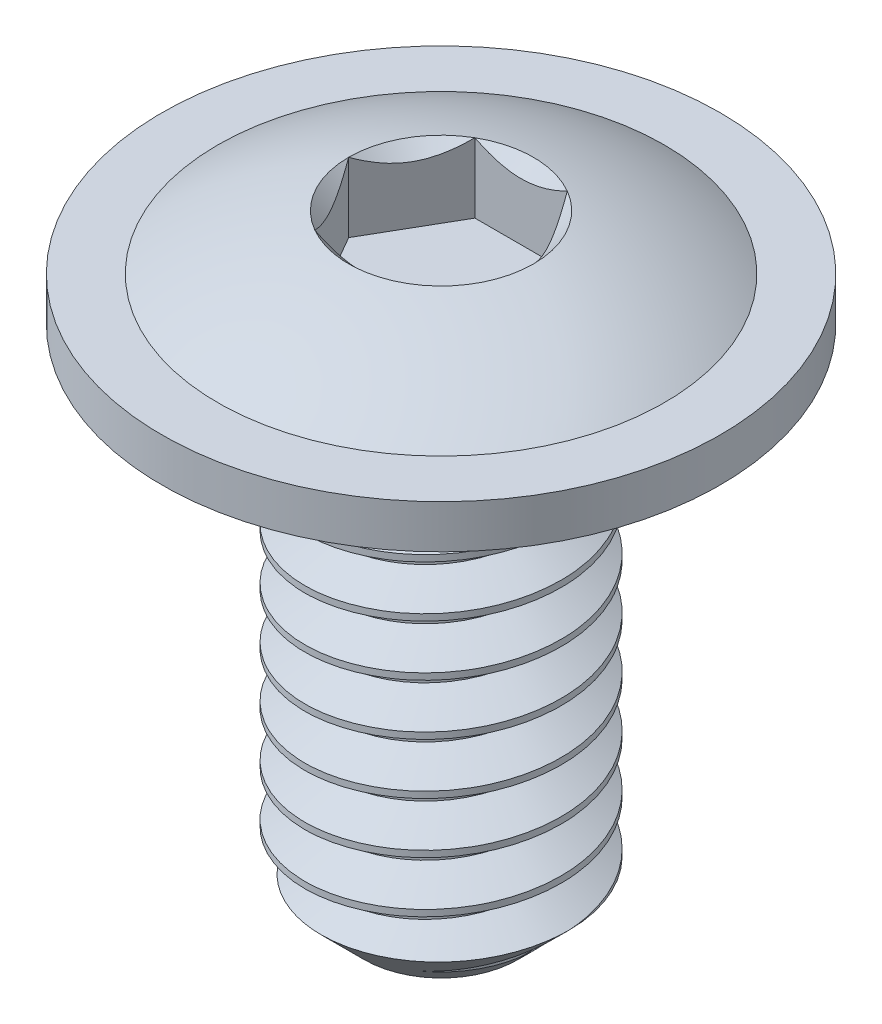
from build123d import *

# Parameters (mm, degrees)
SKETCH2_W                    = 3.175
SKETCH2_H                    = 12.7
CHAMFER1_SIZE                = 1.27
CUT_SWEEP1_PITCH             = 1.27
CUT_EXTRUDE1_DEPTH           = 1.984375
SKETCH7_R                    = 2.291358881
CUT_EXTRUDE2_DEPTH           = 1.726209
CUT_EXTRUDE2_TAPER           = 45
CUT_EXTRUDE2_OTHER_WAY_DEPTH = 19.02385524


with BuildPart() as part:
    # Sketch2 → Revolve2 (revolve)
    with BuildSketch(Plane.XY, mode=Mode.PRIVATE) as revolve2_sk:
        with Locations((-1.5875, 6.35)):
            Rectangle(SKETCH2_W, SKETCH2_H)
    revolve(revolve2_sk.sketch.rotate(Axis((0, 0, 0), (0, 1, 0)), 270), axis=Axis((0, 0, 0), (0, 1, 0)))

    # Chamfer1
    chamfer1_edges = [part.edges().sort_by_distance(p)[0] for p in [
        (0, 0, 3.175),
    ]]
    chamfer(chamfer1_edges, length=CHAMFER1_SIZE)

    # Cut-Sweep1: the profile of Sketch4 profile screwed along a right-hand helix of 13.75 turns, 6 arcs to a turn; built about Z, then put on its axis
    cut_sweep1_z = Axis((0, 0, 0), (0, 0, 1))
    cut_sweep1_corners = [(3.1753, 0, -1.111423205), (3.1753, 0, 0.000173205), (2.350110803, 0, -0.47625), (2.350110803, 0, -0.635)]
    with BuildLine(mode=Mode.PRIVATE) as cut_sweep1_profile:
        Line(cut_sweep1_corners[0], cut_sweep1_corners[1])
        Line(cut_sweep1_corners[1], cut_sweep1_corners[2])
        Line(cut_sweep1_corners[2], cut_sweep1_corners[3])
        Line(cut_sweep1_corners[3], cut_sweep1_corners[0])
    cut_sweep1_cap = Face(cut_sweep1_profile.wire())
    cut_sweep1_turn_angles = [0, 30, 60, 90, 120, 150, 180, 210, 240, 270, 300, 330, 360]
    cut_sweep1_turn_weights = [1, 0.8660254037844387, 1, 0.8660254037844387, 1, 0.8660254037844387, 1, 0.8660254037844387, 1, 0.8660254037844387, 1, 0.8660254037844387, 1]
    cut_sweep1_turn_rails = [Edge.make_bspline([Vector(p[0], p[1], 0).rotate(cut_sweep1_z, cut_sweep1_turn_angles[k]) / cut_sweep1_turn_weights[k] + Vector(0, 0, p[2] + CUT_SWEEP1_PITCH * cut_sweep1_turn_angles[k] / 360) for k in range(13)], [0, 0, 0, 1, 1, 2, 2, 3, 3, 4, 4, 5, 5, 6, 6, 6], 2, cut_sweep1_turn_weights) for p in cut_sweep1_corners]
    cut_sweep1_turn_sides = [Face.make_surface_from_curves(cut_sweep1_turn_rails[p[0]], cut_sweep1_turn_rails[p[1]]) for p in [(0, 1), (1, 2), (2, 3), (3, 0)]]
    cut_sweep1_last_angles = [4680, 4710, 4740, 4770, 4800, 4830, 4860, 4890, 4920, 4935, 4950]
    cut_sweep1_last_weights = [1, 0.8660254037844387, 1, 0.8660254037844387, 1, 0.8660254037844387, 1, 0.8660254037844387, 1, 0.9659258262890539, 1]
    cut_sweep1_last_rails = [Edge.make_bspline([Vector(p[0], p[1], 0).rotate(cut_sweep1_z, cut_sweep1_last_angles[k]) / cut_sweep1_last_weights[k] + Vector(0, 0, p[2] + CUT_SWEEP1_PITCH * cut_sweep1_last_angles[k] / 360) for k in range(11)], [0, 0, 0, 1, 1, 2, 2, 3, 3, 4, 4, 5, 5, 5], 2, cut_sweep1_last_weights) for p in cut_sweep1_corners]
    cut_sweep1_last_sides = [Face.make_surface_from_curves(cut_sweep1_last_rails[p[0]], cut_sweep1_last_rails[p[1]]) for p in [(0, 1), (1, 2), (2, 3), (3, 0)]]
    cut_sweep1 = Plane(origin=(0, 12.7, 0), x_dir=(1, 0, 0), z_dir=(0, -1, 0)) * Solid(Shell([*[p.moved(Location((0, 0, CUT_SWEEP1_PITCH * i))) for i in range(13) for p in cut_sweep1_turn_sides], *cut_sweep1_last_sides, cut_sweep1_cap, cut_sweep1_cap.rotate(cut_sweep1_z, 4950).moved(Location((0, 0, CUT_SWEEP1_PITCH * 4950 / 360)))]))
    add(cut_sweep1, mode=Mode.SUBTRACT)

    # Sketch5 → Revolve3 (revolve)
    with BuildSketch(Plane.XY):
        with BuildLine():
            Line((0, 12.7), (0, 15.3924))
            ThreePointArc((0, 15.3924), (-2.884017607, 14.980293811), (-5.5372, 13.77696))
            Line((-5.5372, 13.77696), (-6.9215, 13.77696))
            Line((-6.9215, 13.77696), (-6.9215, 12.7))
            Line((-6.9215, 12.7), (0, 12.7))
        make_face()
    revolve(axis=Axis((0, 0, 0), (0, 1, 0)))

    # Sketch6 → Cut-Extrude1 (cut)
    with BuildSketch(Plane(origin=(0, 15.3924, 0), x_dir=(-1, 0, 0), z_dir=(0, 1, 0))):
        Polygon((1.14567944, 1.984375), (-1.14567944, 1.984375), (-2.291358881, 0), (-1.14567944, -1.984375), (1.14567944, -1.984375), (2.291358881, 0), align=None)
    extrude(amount=-CUT_EXTRUDE1_DEPTH, mode=Mode.SUBTRACT)

    # Sketch7 → Cut-Extrude2 (cut)
    with BuildSketch(Plane(origin=(0, 15.134233625, 0), x_dir=(-1, 0, 0), z_dir=(0, 1, 0))):
        Circle(SKETCH7_R)
    extrude(amount=-CUT_EXTRUDE2_DEPTH, taper=CUT_EXTRUDE2_TAPER, mode=Mode.SUBTRACT)

    # Sketch7 → Cut-Extrude2 other way (cut)
    with BuildSketch(Plane(origin=(0, 15.134233625, 0), x_dir=(-1, 0, 0), z_dir=(0, 1, 0))):
        Circle(SKETCH7_R)
    extrude(amount=CUT_EXTRUDE2_OTHER_WAY_DEPTH, mode=Mode.SUBTRACT)


solid = part.part
